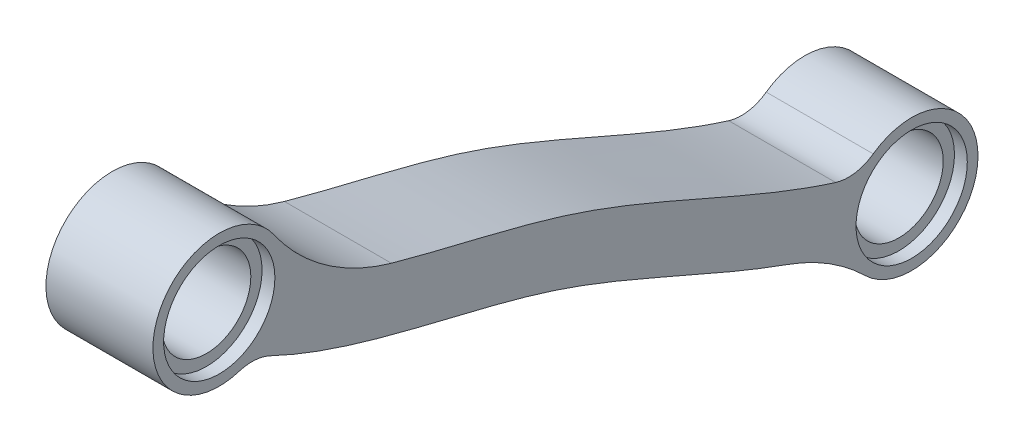
from build123d import *

# Parameters (mm, degrees)
BOSS_EXTRUDE1_START     = -2.5
BOSS_EXTRUDE1_OUTLINE_R = 2.075
BOSS_EXTRUDE1_DEPTH     = 5
FILLET1_R               = 10
FILLET2_R               = 2
SKETCH6_R               = 2.6
CUT_EXTRUDE3_DEPTH      = 0.6
CUT_EXTRUDE4_START      = -0.6
SKETCH7_R               = 2.6
CUT_EXTRUDE4_DEPTH      = 0.6


# Read off the part's stored shape, not the designer's step: Boss-Extrude1
with BuildPart() as part:
    # Boss-Extrude1 outline → Boss-Extrude1 (new body)
    with BuildSketch(Plane(origin=(0, 0, 0), x_dir=(0, 0, -1), z_dir=(1, 0, 0)).offset(BOSS_EXTRUDE1_START)):
        with BuildLine():
            add(Edge.make_bspline(
                [(-11.467759302, 5.348193827), (-9.897325632, 4.539306529), (-6.914913615, 3.521436488), (-2.263899905, 2.426855128), (2.06634335, 1.307705864), (6.2118215, -0.350082751), (10.140310372, -2.114581028), (13.169191833, -3.310542475), (14.923737301, -3.829233653), (15.372310037, -3.948537134)],
                knots=[0.083247791, 0.083247791, 0.083247791, 0.083247791, 0.25, 0.375, 0.5, 0.625, 0.75, 0.875, 0.917679059, 0.917679059, 0.917679059, 0.917679059], degree=3))
            ThreePointArc((-11.467759302, 5.348193827), (-17.179981816, 7.278246829), (-12.961908872, 2.969830498))
            add(Edge.make_bspline(
                [(-12.961908872, 2.969830498), (-12.439456061, 2.692527792), (-10.540790951, 1.792456097), (-7.150824595, 0.699411978), (-2.87827779, -0.304494056), (1.198988752, -1.360799538), (5.069797155, -2.90772863), (9.016006033, -4.678857357), (12.277896091, -5.971009628), (14.261338764, -6.553588571), (14.817570219, -6.697806322)],
                knots=[0.076895227, 0.076895227, 0.076895227, 0.076895227, 0.125, 0.25, 0.375, 0.5, 0.625, 0.75, 0.875, 0.922454156, 0.922454156, 0.922454156, 0.922454156], degree=3))
            ThreePointArc((14.817570219, -6.697806322), (20.84375711, -6.483151878), (15.372310037, -3.948537134))
        make_face()
        with Locations((17.805, -5.87)):
            Circle(BOSS_EXTRUDE1_OUTLINE_R, mode=Mode.SUBTRACT)
        with Locations((-14.555, 5.629165125)):
            Circle(BOSS_EXTRUDE1_OUTLINE_R, mode=Mode.SUBTRACT)
    extrude(amount=BOSS_EXTRUDE1_DEPTH)

    # Fillet1
    fillet1_edges = [part.edges().sort_by_distance(p)[0] for p in [
        (0, -6.697806322, -14.817570219),
        (0, 5.348193827, 11.467759302),
    ]]
    fillet(fillet1_edges, radius=FILLET1_R)

    # Fillet2
    fillet2_edges = [part.edges().sort_by_distance(p)[0] for p in [
        (0, -3.948537134, -15.372310037),
        (0, 2.969830498, 12.961908872),
    ]]
    fillet(fillet2_edges, radius=FILLET2_R)

    # Sketch6 → Cut-Extrude3 (cut)
    with BuildSketch(Plane(origin=(2.5, 0, 0), x_dir=(0, 0, -1), z_dir=(1, 0, 0))):
        with Locations((-14.555, 5.629165125)):
            Circle(SKETCH6_R)
        with Locations((17.805, -5.87)):
            Circle(SKETCH6_R)
    extrude(amount=-CUT_EXTRUDE3_DEPTH, mode=Mode.SUBTRACT)

    # Sketch7 → Cut-Extrude4 (cut)
    with BuildSketch(Plane.ZY.offset(2.5).offset(CUT_EXTRUDE4_START)):
        with Locations(Location((14.555, 5.629165125, 0), (0, 0, 180))):
            Circle(SKETCH7_R)
        with Locations(Location((-17.805, -5.87, 0), (0, 0, 180))):
            Circle(SKETCH7_R)
    extrude(amount=CUT_EXTRUDE4_DEPTH, mode=Mode.SUBTRACT)


solid = part.part
